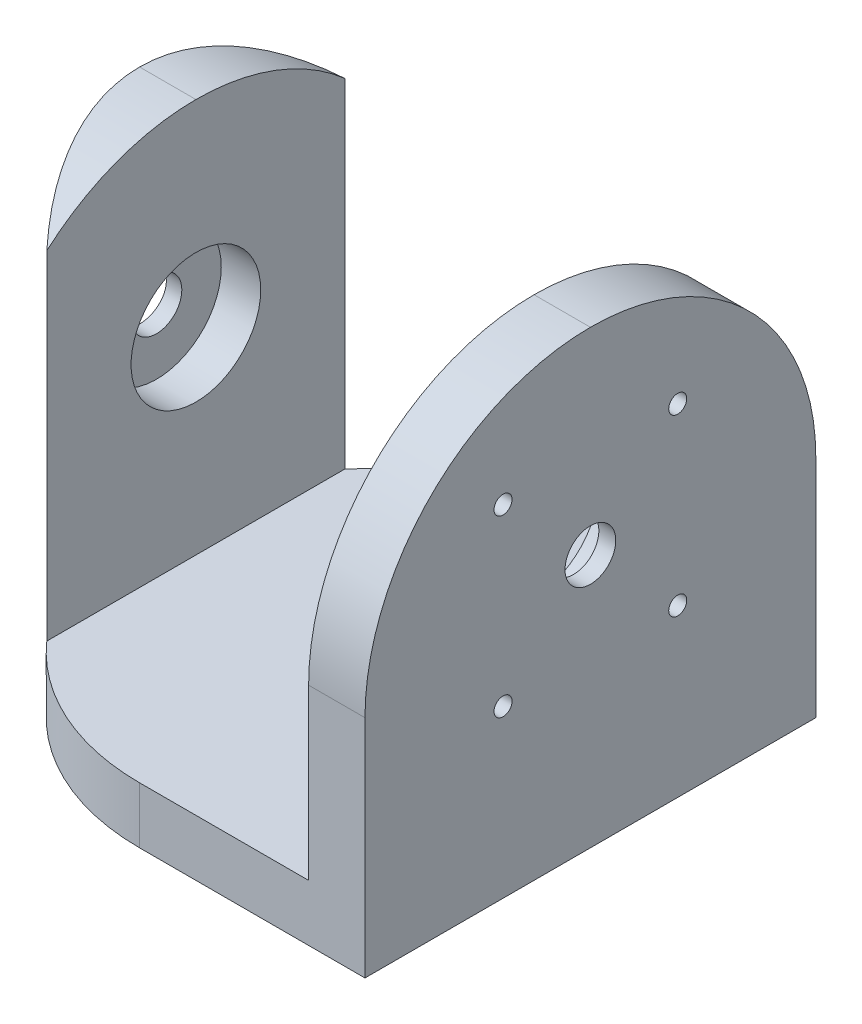
from build123d import *
from build123d.topology import SkipClean

# Parameters (mm, degrees)
SKETCH1_W                                           = 80
SKETCH1_H                                           = 80
BOSS_EXTRUDE1_DEPTH                                 = 10
SKETCH2_W                                           = 10
SKETCH2_H                                           = 80
BOSS_EXTRUDE2_DEPTH                                 = 70
CSK_FOR_M3_COUNTERSUNK_FLAT_HEAD_SCREW1_D           = 3.2
CSK_FOR_M3_COUNTERSUNK_FLAT_HEAD_SCREW1_CSINK_D     = 6.3
CSK_FOR_M3_COUNTERSUNK_FLAT_HEAD_SCREW1_CSINK_ANGLE = 90
CUT_EXTRUDE2_DEPTH                                  = 91
SKETCH7_R                                           = 11.5
CUT_EXTRUDE1_DEPTH                                  = 121
FILLET2_R                                           = 40
SKETCH12_R                                          = 3.625
BOSS_EXTRUDE3_DEPTH                                 = 10
BOSS_EXTRUDE4_START                                 = -7
SKETCH14_R                                          = 11.5
SKETCH14_R_2                                        = 4.5
BOSS_EXTRUDE4_DEPTH                                 = 3
CUT_EXTRUDE4_DEPTH                                  = 98.979589711
BOSS_EXTRUDE5_START                                 = -10
SKETCH15_R                                          = 11.5
SKETCH15_R_2                                        = 4.5
BOSS_EXTRUDE5_DEPTH                                 = 3


with BuildPart() as part:
    # Sketch1 → Boss-Extrude1 (new body)
    with BuildSketch(Plane(origin=(0, 0, 0), x_dir=(1, 0, 0), z_dir=(0, 1, 0))):
        Rectangle(SKETCH1_W, SKETCH1_H)
    extrude(amount=BOSS_EXTRUDE1_DEPTH)

    # Sketch2 → Boss-Extrude2 (add)
    with BuildSketch(Plane(origin=(0, 10, 0), x_dir=(1, 0, 0), z_dir=(0, 1, 0))):
        with Locations((35, 0)):
            Rectangle(SKETCH2_W, SKETCH2_H)
    boss_extrude2 = extrude(amount=BOSS_EXTRUDE2_DEPTH)

    # CSK for M3 Countersunk Flat Head Screw1 (through all)
    with Locations(Plane.ZY.offset(-30)):
        with Locations((-15.5, 60.5), (15.5, 60.5), (15.5, 29.5), (-15.5, 29.5)):
            CounterSinkHole(CSK_FOR_M3_COUNTERSUNK_FLAT_HEAD_SCREW1_D / 2, CSK_FOR_M3_COUNTERSUNK_FLAT_HEAD_SCREW1_CSINK_D / 2, counter_sink_angle=CSK_FOR_M3_COUNTERSUNK_FLAT_HEAD_SCREW1_CSINK_ANGLE)

    # Mirror1: Boss-Extrude2 across plane
    add(boss_extrude2.mirror(Plane(origin=(0, 0, 0), x_dir=(0, 0, 1), z_dir=(1, 0, 0))))

    # Sketch11 → Cut-Extrude2 (cut, through all)
    with BuildSketch(Plane(origin=(0, 10, 0), x_dir=(1, 0, 0), z_dir=(0, 1, 0))):
        with BuildLine():
            Line((-2.281035949, -1.75), (2.281035949, -1.75))
            ThreePointArc((2.281035949, -1.75), (2.722462429, -0.924025608), (2.875, 0))
            ThreePointArc((2.875, 0), (-0.924025608, 2.722462429), (-2.281035949, -1.75))
        make_face()
    extrude(amount=-CUT_EXTRUDE2_DEPTH, mode=Mode.SUBTRACT)

    # Sketch7 → Cut-Extrude1 (cut, through all)
    with BuildSketch(Plane(origin=(40, 0, 0), x_dir=(0, 0, -1), z_dir=(1, 0, 0))):
        with Locations((0, 45)):
            Circle(SKETCH7_R)
    extrude(amount=-CUT_EXTRUDE1_DEPTH, mode=Mode.SUBTRACT)

    # Fillet2
    fillet2_edges = [part.edges().sort_by_distance(p)[0] for p in [
        (35, 80, -40),
        (35, 80, 40),
        (-35, 80, 40),
        (-35, 80, -40),
    ]]
    fillet(fillet2_edges, radius=FILLET2_R - 0.0001)  # a hair under: the kernel refuses the full size

    # Sketch12 → Boss-Extrude3 (add)
    with BuildSketch(Plane.XZ):
        with Locations(Location((0, 0, 0), (0, 0, 270))):
            Circle(SKETCH12_R)
        with BuildLine():
            Line((-2.281035949, 1.75), (2.281035949, 1.75))
            ThreePointArc((2.281035949, 1.75), (0, -2.875), (-2.281035949, 1.75))
        make_face(mode=Mode.SUBTRACT)
    extrude(amount=BOSS_EXTRUDE3_DEPTH)

    # Sketch14 → Boss-Extrude4 (add)
    with BuildSketch(Plane(origin=(-30, 0, 0), x_dir=(0, 0, -1), z_dir=(1, 0, 0)).offset(BOSS_EXTRUDE4_START)):
        with Locations((0, 45)):
            Circle(SKETCH14_R)
        with Locations((0, 45)):
            Circle(SKETCH14_R_2, mode=Mode.SUBTRACT)
    extrude(amount=-BOSS_EXTRUDE4_DEPTH)

    # Sketch13 → Cut-Extrude4 (cut, through all)
    with SkipClean():  # the faces are left unmerged after this step: merging them gives an invalid solid
        with BuildSketch(Plane(origin=(0, 0, 0), x_dir=(-1, 0, 0), z_dir=(0, -1, 0))):
            with BuildLine():
                Line((40, -40), (40, 0))
                ThreePointArc((40, 0), (28.284271346, -28.284271149), (2.79e-07, -40))
                Line((2.79e-07, -40), (40, -40))
            make_face()
            with BuildLine():
                Line((40, 0), (40, 40))
                Line((40, 40), (2.4e-08, 40))
                ThreePointArc((2.4e-08, 40), (28.284271256, 28.284271239), (40, 0))
            make_face()
        extrude(amount=-CUT_EXTRUDE4_DEPTH, mode=Mode.SUBTRACT)

    # Sketch15 → Boss-Extrude5 (add)
    with SkipClean():  # the faces are left unmerged after this step: merging them gives an invalid solid
        with BuildSketch(Plane.ZY.offset(-30).offset(BOSS_EXTRUDE5_START)):
            with Locations(Location((0, 45, 0), (0, 0, 180))):
                Circle(SKETCH15_R)
            with Locations(Location((0, 45, 0), (0, 0, 270))):
                Circle(SKETCH15_R_2, mode=Mode.SUBTRACT)
        extrude(amount=BOSS_EXTRUDE5_DEPTH)


solid = part.part
